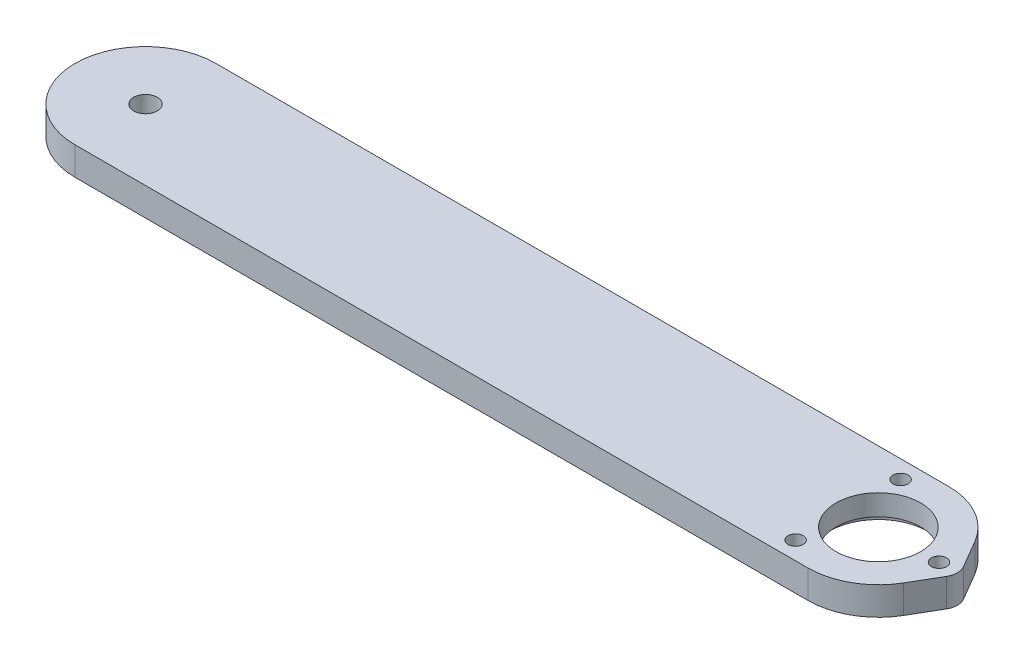
from build123d import *

# Parameters (mm, degrees)
EXTRUDE_1_DEPTH     = 5
EXTRUDE_5_DEPTH     = 5
CUT_EXTRUDE_2_REACH = 82.139
SKETCH_7_R          = 7.5
SKETCH_8_R          = 8.75
CUT_EXTRUDE_3_DEPTH = 1.3
CUT_EXTRUDE_4_REACH = 82.139
SKETCH_9_R          = 1.35
CUT_EXTRUDE_5_REACH = 82.139
SKETCH_12_R         = 2.1
SKETCH_14_W         = 40
SKETCH_14_H         = 7
EXTRUDE_6_DEPTH     = 15
CHAMFER_1_SIZE      = 7
CHAMFER_1_SIZE2     = 3
CUT_EXTRUDE_6_REACH = 134.447
SKETCH_15_R         = 2
FILLET_3_R          = 2
CHAMFER_2_SIZE      = 5
CUT_EXTRUDE_7_DEPTH = 15
SKETCH_17_R         = 7.5
SKETCH_17_R_2       = 2.1
EXTRUDE_7_DEPTH     = 2
CHAMFER_3_SIZE      = 2


# Some blends are built 0.0001 mm under size
with BuildPart() as part:
    # 草图1 → 凸台-拉伸1 (new body)
    with BuildSketch(Plane(origin=(0, 0, 0), x_dir=(1, 0, 0), z_dir=(0, 1, 0))):
        with BuildLine():
            Line((-65, 12.5), (65, 12.5))
            ThreePointArc((65, 12.5), (77.5, 0), (65, -12.5))
            Line((65, -12.5), (-65, -12.5))
            ThreePointArc((-65, -12.5), (-77.5, 0), (-65, 12.5))
        make_face()
    extrude(amount=EXTRUDE_1_DEPTH)

    # 草图10 → 凸台-拉伸5 (add)
    with BuildSketch(Plane.XZ):
        with BuildLine():
            Line((75.795454545, -6.301441197), (78.590909091, -1.512345887))
            ThreePointArc((78.590909091, -1.512345887), (79, 0), (78.590909091, 1.512345887))
            Line((78.590909091, 1.512345887), (75.795454545, 6.301441197))
            Line((75.795454545, 6.301441197), (75.795454545, -6.301441197))
        make_face()
    extrude(amount=-EXTRUDE_5_DEPTH)

    # 草图7 → 切除-拉伸2 (cut, up to next)
    with BuildSketch(Plane(origin=(0, 5, 0), x_dir=(1, 0, 0), z_dir=(0, 1, 0)), mode=Mode.PRIVATE) as cut_extrude_2_sk1:
        with Locations(Location((65, 0, 0), (0, 0, 270))):
            Circle(SKETCH_7_R)
    cut_extrude_2_tool1 = extrude(cut_extrude_2_sk1.sketch, amount=-CUT_EXTRUDE_2_REACH, mode=Mode.PRIVATE) & part.part
    add(cut_extrude_2_tool1.solids().sort_by_distance((65, 5, 0))[0], mode=Mode.SUBTRACT)

    # 草图8 → 切除-拉伸3 (cut)
    with BuildSketch(Plane(origin=(0, 0, 0), x_dir=(1, 0, 0), z_dir=(0, 1, 0))):
        with Locations(Location((65, 0, 0), (0, 0, 270))):
            Circle(SKETCH_8_R)
    extrude(amount=CUT_EXTRUDE_3_DEPTH, mode=Mode.SUBTRACT)

    # 草图9 → 切除-拉伸4 (cut, up to next)
    with BuildSketch(Plane.XZ, mode=Mode.PRIVATE) as cut_extrude_4_sk1:
        with Locations(Location((59.625, 9.309773091, 0), (0, 0, 270))):
            Circle(SKETCH_9_R)
    cut_extrude_4_tool1 = extrude(cut_extrude_4_sk1.sketch, amount=-CUT_EXTRUDE_4_REACH, mode=Mode.PRIVATE) & part.part
    # 草图9 → 切除-拉伸4 (cut, up to next)
    with BuildSketch(Plane.XZ, mode=Mode.PRIVATE) as cut_extrude_4_sk2:
        with Locations(Location((75.75, 0, 0), (0, 0, 270))):
            Circle(SKETCH_9_R)
    cut_extrude_4_tool2 = extrude(cut_extrude_4_sk2.sketch, amount=-CUT_EXTRUDE_4_REACH, mode=Mode.PRIVATE) & part.part
    # 草图9 → 切除-拉伸4 (cut, up to next)
    with BuildSketch(Plane.XZ, mode=Mode.PRIVATE) as cut_extrude_4_sk3:
        with Locations(Location((59.625, -9.309773091, 0), (0, 0, 270))):
            Circle(SKETCH_9_R)
    cut_extrude_4_tool3 = extrude(cut_extrude_4_sk3.sketch, amount=-CUT_EXTRUDE_4_REACH, mode=Mode.PRIVATE) & part.part
    add(cut_extrude_4_tool1.solids().sort_by_distance((59.625, 0, 9.309773))[0], mode=Mode.SUBTRACT)
    add(cut_extrude_4_tool2.solids().sort_by_distance((75.75, 0, 0))[0], mode=Mode.SUBTRACT)
    add(cut_extrude_4_tool3.solids().sort_by_distance((59.625, 0, -9.309773))[0], mode=Mode.SUBTRACT)

    # 草图12 → 切除-拉伸5 (cut, up to next)
    with BuildSketch(Plane(origin=(0, 5, 0), x_dir=(1, 0, 0), z_dir=(0, 1, 0)), mode=Mode.PRIVATE) as cut_extrude_5_sk1:
        with Locations(Location((-65, 0, 0), (0, 0, 270))):
            Circle(SKETCH_12_R)
    cut_extrude_5_tool1 = extrude(cut_extrude_5_sk1.sketch, amount=-CUT_EXTRUDE_5_REACH, mode=Mode.PRIVATE) & part.part
    add(cut_extrude_5_tool1.solids().sort_by_distance((-65, 5, 0))[0], mode=Mode.SUBTRACT)

    # 草图14 → 凸台-拉伸6 (add)
    with BuildSketch(Plane.XZ):
        with Locations((-32, -9)):
            Rectangle(SKETCH_14_W, SKETCH_14_H)
    extrude(amount=EXTRUDE_6_DEPTH)

    # 倒角1
    chamfer_1_edges = [part.edges().sort_by_distance(p)[0] for p in [
        (-52, -7.5, -5.5),
    ]]
    chamfer_1_side = [part.faces().sort_by_distance(p)[0] for p in [
        (-32, -7.5, -5.5),
    ]]
    chamfer(chamfer_1_edges, length=CHAMFER_1_SIZE, length2=CHAMFER_1_SIZE2, reference=chamfer_1_side[0])

    # 草图15 → 切除-拉伸6 (cut, up to next)
    with BuildSketch(Plane.ZY.offset(52), mode=Mode.PRIVATE) as cut_extrude_6_sk1:
        with Locations((-4.5, -12.5)):
            Circle(SKETCH_15_R)
    cut_extrude_6_tool1 = extrude(cut_extrude_6_sk1.sketch, amount=-CUT_EXTRUDE_6_REACH, mode=Mode.PRIVATE) & part.part
    add(cut_extrude_6_tool1.solids().sort_by_distance((-52, -12.5, -4.5))[0], mode=Mode.SUBTRACT)

    # 圆角3
    # the kernel refuses this fillet: 2 mm, written as the material it takes off along each edge
    with BuildSketch(Plane(origin=(-52, 0, -8.5), x_dir=(0.9191450300180579, 0, 0.39391929857916774), z_dir=(0, -1, 0))) as fillet_3_piece_1:
        with BuildLine():
            CenterArc((FILLET_3_R * 0.659396157981, -FILLET_3_R), FILLET_3_R, 90, 66.801409486)
            Line((-FILLET_3_R * 0.259748872037, -FILLET_3_R * 0.606080701421), (0, 0))
            Line((0, 0), (FILLET_3_R * 0.659396157981, 0))
        make_face()
    extrude(amount=18.29698079, mode=Mode.SUBTRACT)
    with BuildSketch(Plane(origin=(-52, 0, -12.5), x_dir=(0, 0, 1), z_dir=(0, -1, 0))) as fillet_3_piece_2:
        with BuildLine():
            CenterArc((FILLET_3_R, -FILLET_3_R), FILLET_3_R, 90, 90)
            Line((0, -FILLET_3_R), (0, 0))
            Line((0, 0), (FILLET_3_R, 0))
        make_face()
    extrude(amount=20, mode=Mode.SUBTRACT)
    with BuildSketch(Plane(origin=(-45, -13.205762298, -5.5), x_dir=(-0.9191450300180575, 0, -0.3939192985791687), z_dir=(0, -1, 0))) as fillet_3_piece_3:
        with BuildLine():
            CenterArc((FILLET_3_R * 0.205257701955, FILLET_3_R), FILLET_3_R, 246.801409486, 23.198590514)
            Line((-FILLET_3_R * 0.188661596625, FILLET_3_R * 0.0808549699819), (0, 0))
            Line((0, 0), (FILLET_3_R * 0.205257701955, 0))
        make_face()
    extrude(amount=2.820526212, mode=Mode.SUBTRACT)
    with BuildSketch(Plane(origin=(-45, 0, -5.5), x_dir=(1, 0, 0), z_dir=(0, -1, 0))) as fillet_3_piece_4:
        with BuildLine():
            CenterArc((FILLET_3_R * 0.205257701955, -FILLET_3_R), FILLET_3_R, 90, 23.198590514)
            Line((-FILLET_3_R * 0.188661596625, -FILLET_3_R * 0.0808549699819), (0, 0))
            Line((0, 0), (FILLET_3_R * 0.205257701955, 0))
        make_face()
    extrude(amount=11.794237702, mode=Mode.SUBTRACT)
    with BuildSketch(Plane(origin=(-12, 0, -5.5), x_dir=(-1, 0, 0), z_dir=(0, -1, 0))) as fillet_3_piece_5:
        with BuildLine():
            CenterArc((FILLET_3_R, FILLET_3_R), FILLET_3_R, 180, 90)
            Line((0, FILLET_3_R), (0, 0))
            Line((0, 0), (FILLET_3_R, 0))
        make_face()
    extrude(amount=15.767949192, mode=Mode.SUBTRACT)
    with BuildSketch(Plane(origin=(-12, -9.232050808, -5.5), x_dir=(0, 0, -1), z_dir=(0, -1, 0))) as fillet_3_piece_6:
        with BuildLine():
            CenterArc((FILLET_3_R, -FILLET_3_R), FILLET_3_R, 90, 90)
            Line((0, -FILLET_3_R), (0, 0))
            Line((0, 0), (FILLET_3_R, 0))
        make_face()
    extrude(amount=10.767949192, mode=Mode.SUBTRACT)
    with BuildSketch(Plane(origin=(-12, 0, -12.5), x_dir=(0, 0, 1), z_dir=(0, -1, 0))) as fillet_3_piece_7:
        with BuildLine():
            CenterArc((FILLET_3_R, FILLET_3_R), FILLET_3_R, 180, 90)
            Line((0, FILLET_3_R), (0, 0))
            Line((0, 0), (FILLET_3_R, 0))
        make_face()
    extrude(amount=20, mode=Mode.SUBTRACT)

    # 倒角2
    chamfer_2_edges = [part.edges().sort_by_distance(p)[0] for p in [
        (-29.294742298, 0, -5.5),
        (-12, 0, -9),
        (-51.669682184, 0, -8.717810298),
        (-51.414213562, 0, -11.914213562),
        (-44.991616341, 0, -5.540844554),
        (-12.585786438, 0, -6.085786438),
        (-12.585786438, 0, -11.914213562),
        (-52, 0, -10.159396158),
        (-48.082580895, 0, -6.821106098),
    ]]
    chamfer(chamfer_2_edges, length=CHAMFER_2_SIZE)

    # 草图16 → 切除-拉伸7 (cut)
    with BuildSketch(Plane.XZ.offset(15)):
        Polygon((-61.333333333, -12.5), (-33.333333333, -0.5), (-61.333333333, -0.5), align=None)
    extrude(amount=-CUT_EXTRUDE_7_DEPTH, mode=Mode.SUBTRACT)

    # 草图17 → 凸台-拉伸7 (add)
    with BuildSketch(Plane.XZ):
        with Locations(Location((-65, 0, 0), (0, 0, 90))):
            Circle(SKETCH_17_R)
        with Locations(Location((-65, 0, 0), (0, 0, 90))):
            Circle(SKETCH_17_R_2, mode=Mode.SUBTRACT)
    extrude(amount=EXTRUDE_7_DEPTH)

    # 倒角3
    chamfer_3_edges = [part.edges().sort_by_distance(p)[0] for p in [
        (-65, -2, -7.5),
    ]]
    chamfer(chamfer_3_edges, length=CHAMFER_3_SIZE - 0.0001)  # a hair under: the kernel refuses the full size


solid = part.part
